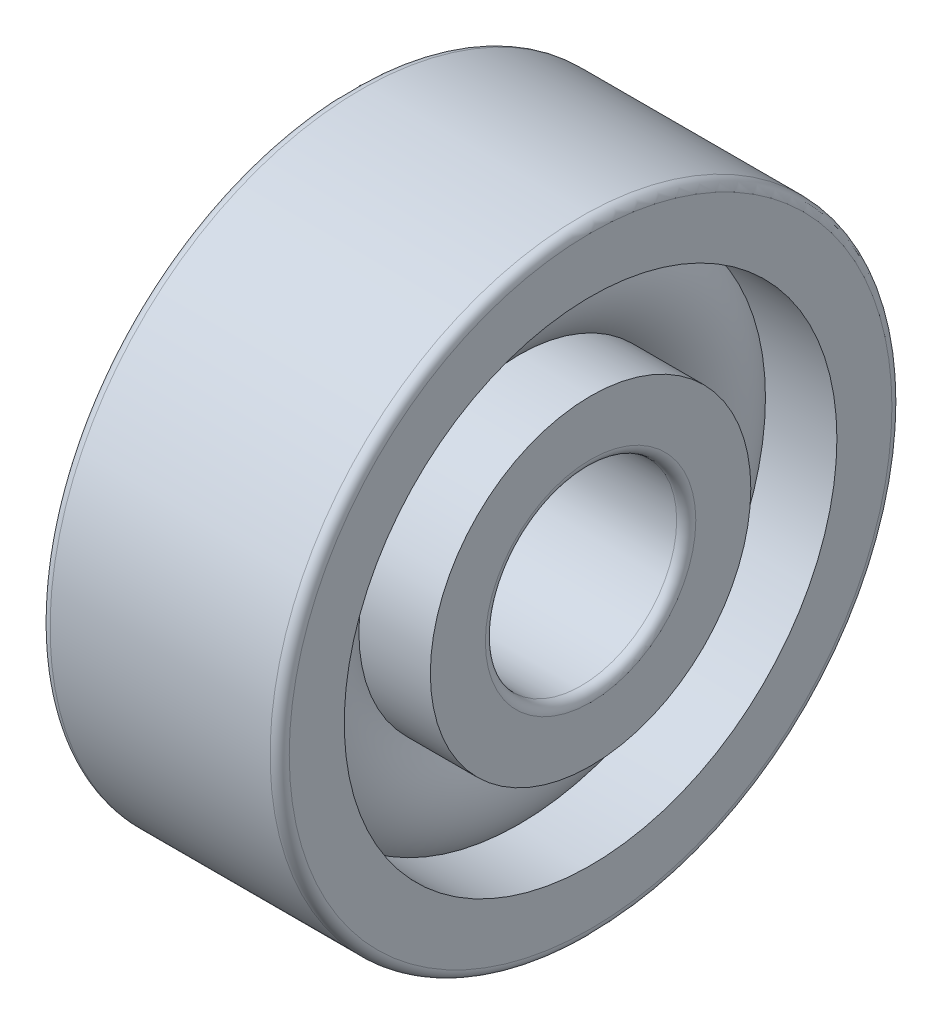
from build123d import *

# Parameters (mm, degrees)
CAGSPISKE_W     = 0.27
CAGSPISKE_H     = 0.45
CAGESPINE_ANGLE = 0.001
BALSIMSKE_R     = 1.35


with BuildPart() as part:
    # CagSpiSke → CageSpine (revolve)
    with BuildSketch(Plane.XY):
        with Locations((0, 4.25)):
            Rectangle(CAGSPISKE_W, CAGSPISKE_H)
    revolve(axis=Axis((-20.6375, 0, 0), (-1, 0, 0)), revolution_arc=CAGESPINE_ANGLE)

    # BalSimSke → BallsSimplified (revolve)
    with BuildSketch(Plane.XY):
        with Locations((0, 4.25)):
            Circle(BALSIMSKE_R)
    revolve(axis=Axis((-10, 0, 0), (1, 0, 0)))

    # InnRacSke → InnerRace (revolve)
    with BuildSketch(Plane.XY):
        with BuildLine():
            Line((-0.972432517, 3.35), (-2.5, 3.35))
            Line((-2.5, 3.35), (-2.5, 2.2))
            ThreePointArc((-2.5, 2.2), (-2.441421356, 2.058578644), (-2.3, 2))
            Line((-2.3, 2), (2.3, 2))
            ThreePointArc((2.3, 2), (2.441421356, 2.058578644), (2.5, 2.2))
            Line((2.5, 2.2), (2.5, 3.35))
            Line((2.5, 3.35), (0.972432517, 3.35))
            ThreePointArc((0.972432517, 3.35), (0, 2.925), (-0.972432517, 3.35))
        make_face()
    revolve(axis=Axis((-20.6375, 0, 0), (1, 0, 0)))

    # OutRacSke → OuterRace (revolve)
    with BuildSketch(Plane.XY):
        with BuildLine():
            Line((-0.972432517, 5.15), (-2.5, 5.15))
            Line((-2.5, 5.15), (-2.5, 6.3))
            ThreePointArc((-2.5, 6.3), (-2.441421356, 6.441421356), (-2.3, 6.5))
            Line((-2.3, 6.5), (2.3, 6.5))
            ThreePointArc((2.3, 6.5), (2.441421356, 6.441421356), (2.5, 6.3))
            Line((2.5, 6.3), (2.5, 5.15))
            Line((2.5, 5.15), (0.972432517, 5.15))
            ThreePointArc((0.972432517, 5.15), (0, 5.575), (-0.972432517, 5.15))
        make_face()
    revolve(axis=Axis((-20.6375, 0, 0), (1, 0, 0)))


solid = part.part
